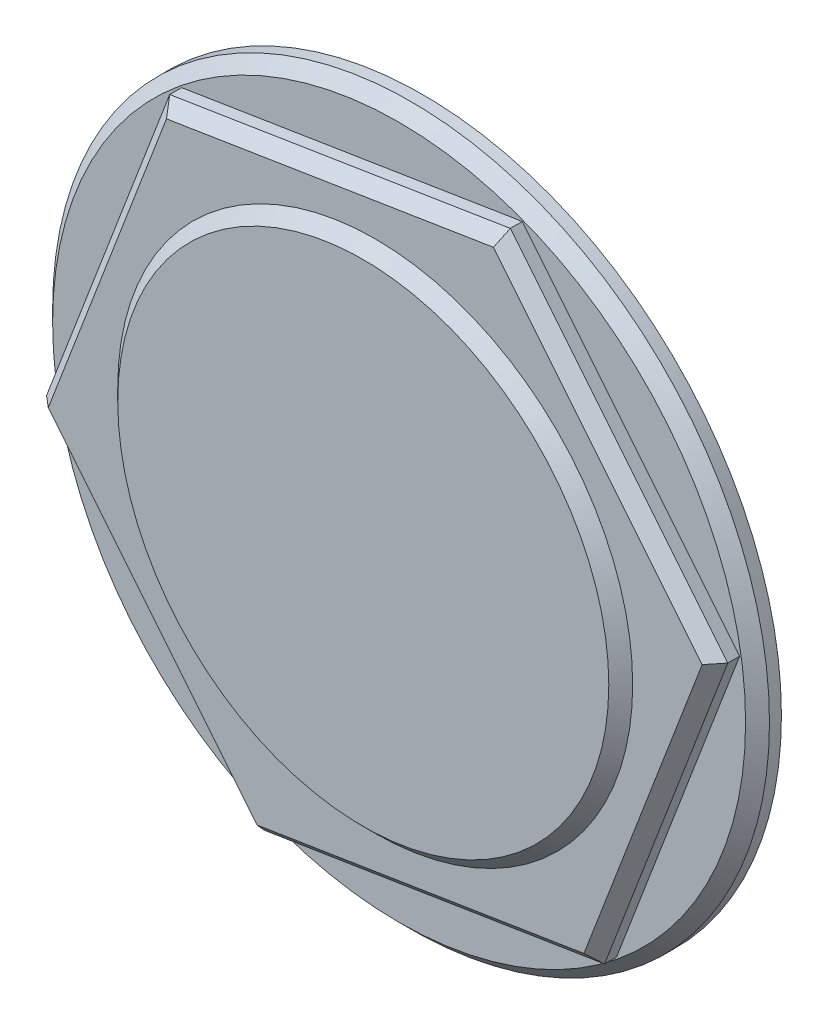
from build123d import *

# Parameters (mm, degrees)
SKETCH_1_R      = 30
EXTRUDE_1_DEPTH = 2
EXTRUDE_2_DEPTH = 2
SKETCH_3_R      = 21.549788195
EXTRUDE_3_DEPTH = 1
CHAMFER_1_SIZE  = 1
CHAMFER_2_SIZE  = 1
CHAMFER_3_SIZE  = 1


with BuildPart() as part:
    # Эскиз1 → Бобышка-Вытянуть1 (new body)
    with BuildSketch(Plane.XY):
        with Locations((-49.331170663, 19.945627645)):
            Circle(SKETCH_1_R)
    extrude(amount=EXTRUDE_1_DEPTH)

    # Эскиз2 → Бобышка-Вытянуть2 (add)
    with BuildSketch(Plane.XY.offset(2)):
        Polygon((-20.825153864, 24.499783942), (-39.02217731, 46.909640502), (-67.528194109, 42.355484205), (-77.837187462, 15.391471347), (-59.640164016, -7.018385213), (-31.134147217, -2.464228916), align=None)
    extrude(amount=EXTRUDE_2_DEPTH)

    # Эскиз3 → Бобышка-Вытянуть3 (add)
    with BuildSketch(Plane.XY.offset(4)):
        with Locations((-49.331170663, 19.945627645)):
            Circle(SKETCH_3_R)
    extrude(amount=EXTRUDE_3_DEPTH)

    # Фаска1
    chamfer_1_edges = [part.edges().sort_by_distance(p)[0] for p in [
        (-25.97965054, 11.017777513, 4),
        (-29.923665587, 35.704712222, 4),
        (-53.275185709, 44.632562353, 4),
        (-72.682690785, 28.873477776, 4),
        (-68.738675739, 4.186543067, 4),
        (-45.387155617, -4.741307064, 4),
    ]]
    chamfer(chamfer_1_edges, length=CHAMFER_1_SIZE)

    # Фаска2
    chamfer_2_edges = [part.edges().sort_by_distance(p)[0] for p in [
        (-70.880958858, 19.945627645, 5),
    ]]
    chamfer(chamfer_2_edges, length=CHAMFER_2_SIZE - 0.0001)  # a hair under: the kernel refuses the full size

    # Фаска3
    chamfer_3_edges = [part.edges().sort_by_distance(p)[0] for p in [
        (-79.331170663, 19.945627645, 2),
    ]]
    chamfer(chamfer_3_edges, length=CHAMFER_3_SIZE)


solid = part.part
